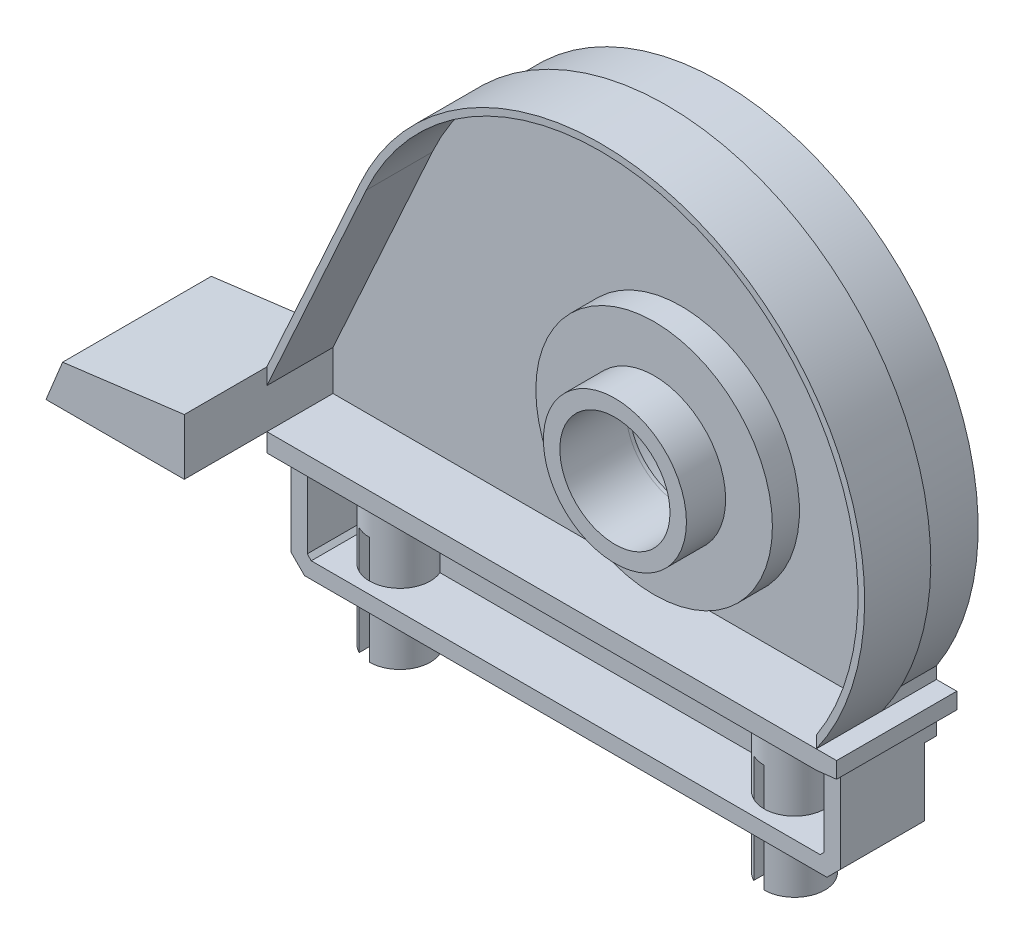
from build123d import *

# Parameters (mm, degrees)
BOSS_EXTRUDE1_DEPTH  = 4
SHELL1_T             = -1.2
SKETCH3_R            = 10.575
BOSS_EXTRUDE2_DEPTH  = 2.75
SKETCH4_R            = 8.7
SKETCH4_R_2          = 7.595
BOSS_EXTRUDE3_DEPTH  = 0.5
CHAMFER1_SIZE        = 2.75
CUT_EXTRUDE2_START   = -3.68
SKETCH5_R            = 7.595
CUT_EXTRUDE2_DEPTH   = 3.68
SKETCH6_R            = 4.09
CUT_EXTRUDE3_DEPTH   = 3.68
SKETCH7_W            = 40.64
SKETCH7_H            = 4.5
BOSS_EXTRUDE5_DEPTH  = 6
SKETCH18_W           = 40.64
SKETCH18_H           = 4.5
CUT_EXTRUDE10_DEPTH  = 2
BOSS_EXTRUDE16_DEPTH = 4.89
SKETCH20_W           = 40.64
SKETCH20_H           = 1.367101803
BOSS_EXTRUDE17_DEPTH = 4.89
BOSS_EXTRUDE18_DEPTH = 4.89
BOSS_EXTRUDE19_DEPTH = 4
BOSS_EXTRUDE24_DEPTH = 11
SKETCH31_W           = 40.64
SKETCH31_H           = 6.21
BOSS_EXTRUDE32_DEPTH = 6
CHAMFER2_SIZE        = 1
CHAMFER3_SIZE        = 1
SKETCH32_R           = 2.25
BOSS_EXTRUDE33_DEPTH = 4
SKETCH33_R           = 2.25
BOSS_EXTRUDE34_DEPTH = 4
SKETCH34_R           = 1
CUT_EXTRUDE14_DEPTH  = 8
CUT_EXTRUDE16_DEPTH  = 8
SKETCH37_R           = 1
CUT_EXTRUDE17_DEPTH  = 8
CUT_EXTRUDE19_DEPTH  = 8
SKETCH42_R           = 5.29
BOSS_EXTRUDE36_DEPTH = 4.9
SKETCH47_R           = 4.075
CUT_EXTRUDE21_DEPTH  = 21.9
SKETCH55_W           = 40.64
SKETCH55_H           = 3.105
BOSS_EXTRUDE47_DEPTH = 2.25
SKETCH59_W           = 1
SKETCH59_H           = 4
CUT_EXTRUDE29_DEPTH  = 1.08944
CUT_EXTRUDE35_DEPTH  = 4
BOSS_EXTRUDE54_START = 6
SKETCH70_R           = 2.25
BOSS_EXTRUDE54_DEPTH = 6
SKETCH66_R           = 8.75
BOSS_EXTRUDE66_DEPTH = 2
SKETCH71_R           = 2.25
BOSS_EXTRUDE71_DEPTH = 6
CUT_EXTRUDE39_DEPTH  = 8
CUT_EXTRUDE40_START  = -8
CUT_EXTRUDE40_DEPTH  = 8
SKETCH73_W           = 1
SKETCH73_H           = 4
CUT_EXTRUDE41_DEPTH  = 1.089436
CUT_EXTRUDE42_DEPTH  = 6
CUT_EXTRUDE43_START  = -6
CUT_EXTRUDE43_DEPTH  = 6
SKETCH79_R           = 4.075
CUT_EXTRUDE47_DEPTH  = 7


with BuildPart() as part:
    # Sketch1 → Boss-Extrude1 (new body)
    with BuildSketch(Plane.XY):
        with BuildLine():
            Line((-24.108496543, -7.116270468), (-24.108496543, -5.046270468))
            Line((-24.108496543, -5.046270468), (-16.768496543, 11.136920555))
            ThreePointArc((-16.768496543, 11.136920555), (9.72561941, 19.969325243), (16.531503457, -7.116270468))
            Line((16.531503457, -7.116270468), (16.531503457, -11.616270468))
            Line((16.531503457, -11.616270468), (-24.108496543, -11.616270468))
            Line((-24.108496543, -11.616270468), (-24.108496543, -7.116270468))
        make_face()
    extrude(amount=BOSS_EXTRUDE1_DEPTH)

    # Shell1
    shell1_openings = [part.faces().sort_by_distance(p)[0] for p in [
        (-1.110099133, 3.328032684, 0),
    ]]
    offset(amount=SHELL1_T, openings=shell1_openings, kind=Kind.INTERSECTION)

    # Sketch3 → Boss-Extrude2 (add)
    with BuildSketch(Plane(origin=(0, 0, 2.8), x_dir=(-1, 0, 0), z_dir=(0, 0, -1))):
        with Locations((-1.644644565, 1.733101785)):
            Circle(SKETCH3_R)
    extrude(amount=BOSS_EXTRUDE2_DEPTH)

    # Sketch4 → Boss-Extrude3 (add)
    with BuildSketch(Plane(origin=(0, 0, 0.05), x_dir=(-1, 0, 0), z_dir=(0, 0, -1))):
        with Locations((-1.644644565, 1.733101785)):
            Circle(SKETCH4_R)
        with Locations((-1.644644565, 1.733101785)):
            Circle(SKETCH4_R_2, mode=Mode.SUBTRACT)
    extrude(amount=BOSS_EXTRUDE3_DEPTH)

    # Chamfer1
    # the kernel refuses this chamfer: 2.75 mm, written as the material it takes off along each edge
    with BuildSketch(Plane(origin=(1.644644565, 1.733101785, 0.05), x_dir=(-1, 0, 0), z_dir=(0, -1, 0))) as chamfer1_piece_1_section:
        Polygon((10.575, -CHAMFER1_SIZE), (10.575 - CHAMFER1_SIZE, 0), (10.575, 0), align=None)
    chamfer1_piece_1 = revolve(axis=Axis((1.644644565, 1.733101785, 0.05), (0, 0, -1)), mode=Mode.PRIVATE)
    chamfer1_piece_1 = split(chamfer1_piece_1, bisect_by=Plane(origin=(11.325301981, 1.733101785, 2.8), z_dir=(0, 0, -1)), keep=Keep.TOP, mode=Mode.PRIVATE)
    chamfer1_piece_1 = chamfer1_piece_1 - Plane(origin=(1.644644565, 1.733101785, 1.819342584), x_dir=(-1, 0, 0), z_dir=(0, 0, 1)) * Cylinder(8.7, 43, mode=Mode.PRIVATE)
    add(chamfer1_piece_1, mode=Mode.SUBTRACT)

    # Sketch5 → Cut-Extrude2 (cut)
    with BuildSketch(Plane(origin=(0, 0, 0.05), x_dir=(-1, 0, 0), z_dir=(0, 0, -1)).offset(CUT_EXTRUDE2_START)):
        with Locations((-1.644644565, 1.733101785)):
            Circle(SKETCH5_R)
    extrude(amount=CUT_EXTRUDE2_DEPTH, mode=Mode.SUBTRACT)

    # Sketch6 → Cut-Extrude3 (cut)
    with BuildSketch(Plane(origin=(0, 0, 3.73), x_dir=(-1, 0, 0), z_dir=(0, 0, -1))):
        with Locations((-1.644644565, 1.733101785)):
            Circle(SKETCH6_R)
    extrude(amount=-CUT_EXTRUDE3_DEPTH, mode=Mode.SUBTRACT)

    # Sketch7 → Boss-Extrude5 (add)
    with BuildSketch(Plane.XY):
        with Locations((-3.788496543, -9.366270468)):
            Rectangle(SKETCH7_W, SKETCH7_H)
    extrude(amount=BOSS_EXTRUDE5_DEPTH)

    # Sketch18 → Cut-Extrude10 (cut)
    with BuildSketch(Plane.XY.offset(6)):
        with Locations((-3.788496543, -9.366270468)):
            Rectangle(SKETCH18_W, SKETCH18_H)
    extrude(amount=-CUT_EXTRUDE10_DEPTH, mode=Mode.SUBTRACT)

    # Sketch20 → Boss-Extrude17 (add)
    with BuildSketch(Plane.XY.offset(4)):
        with Locations((-3.788496543, -8.682719567)):
            Rectangle(SKETCH20_W, SKETCH20_H)
    extrude(amount=BOSS_EXTRUDE17_DEPTH)

    # Sketch21 → Boss-Extrude18 (add)
    with BuildSketch(Plane.XY.offset(4)):
        Polygon((16.531503457, -7.999168665), (18.031503457, -7.999168665), (18.031503457, -9.199168665), (16.531503457, -9.366270468), align=None)
    extrude(amount=BOSS_EXTRUDE18_DEPTH)

    # Sketch22 → Boss-Extrude19 (add)
    with BuildSketch(Plane(origin=(0, 0, 4), x_dir=(-1, 0, 0), z_dir=(0, 0, -1))):
        Polygon((-16.531503457, -7.999168665), (-18.031503457, -7.999168665), (-18.031503457, -9.199168665), (-16.531503457, -9.366270468), align=None)
    extrude(amount=BOSS_EXTRUDE19_DEPTH)

    # Sketch31 → Boss-Extrude32 (add)
    with BuildSketch(Plane.XZ.offset(11.616270468)):
        with Locations((-3.788496543, 4)):
            Rectangle(SKETCH31_W, SKETCH31_H)
    extrude(amount=BOSS_EXTRUDE32_DEPTH)

    # Chamfer2
    chamfer2_edges = [part.edges().sort_by_distance(p)[0] for p in [
        (-24.108496543, -17.616270468, 4),
    ]]
    chamfer(chamfer2_edges, length=CHAMFER2_SIZE)

    # Chamfer3
    chamfer3_edges = [part.edges().sort_by_distance(p)[0] for p in [
        (16.531503457, -17.616270468, 4),
    ]]
    chamfer(chamfer3_edges, length=CHAMFER3_SIZE)

    # Sketch32 → Boss-Extrude33 (add)
    with BuildSketch(Plane.XZ.offset(17.616270468)):
        with Locations(Location((-19.158496543, 4, 0), (0, 0, 90))):
            Circle(SKETCH32_R)
    extrude(amount=BOSS_EXTRUDE33_DEPTH)

    # Sketch33 → Boss-Extrude34 (add)
    with BuildSketch(Plane.XZ.offset(17.616270468)):
        with Locations(Location((10.031503457, 4, 0), (0, 0, 90))):
            Circle(SKETCH33_R)
    extrude(amount=BOSS_EXTRUDE34_DEPTH)

    # Sketch34 → Cut-Extrude14 (cut)
    with BuildSketch(Plane.XZ.offset(21.616270468)):
        with Locations(Location((-19.158496543, 4, 0), (0, 0, 270))):
            Circle(SKETCH34_R)
    extrude(amount=-CUT_EXTRUDE14_DEPTH, mode=Mode.SUBTRACT)

    # Sketch36 → Cut-Extrude16 (cut)
    with BuildSketch(Plane(origin=(0, -21.616270468, 0), x_dir=(-1, 0, 0), z_dir=(0, -1, 0))):
        with BuildLine():
            Line((18.158496543, -4), (18.158496543, -1.984435563))
            ThreePointArc((18.158496543, -1.984435563), (18.644940306, -1.80939278), (19.158496543, -1.75))
            Line((19.158496543, -1.75), (19.158496543, -3))
            ThreePointArc((19.158496543, -3), (18.451389761, -3.292893219), (18.158496543, -4))
        make_face()
    extrude(amount=-CUT_EXTRUDE16_DEPTH, mode=Mode.SUBTRACT)

    # Sketch37 → Cut-Extrude17 (cut)
    with BuildSketch(Plane.XZ.offset(21.616270468)):
        with Locations(Location((10.031503457, 4, 0), (0, 0, 270))):
            Circle(SKETCH37_R)
    extrude(amount=-CUT_EXTRUDE17_DEPTH, mode=Mode.SUBTRACT)

    # Sketch39 → Cut-Extrude19 (cut)
    with BuildSketch(Plane(origin=(0, -21.616270468, 0), x_dir=(-1, 0, 0), z_dir=(0, -1, 0))):
        with BuildLine():
            Line((-11.031503457, -4), (-11.031503457, -1.984435563))
            ThreePointArc((-11.031503457, -1.984435563), (-10.545059694, -1.80939278), (-10.031503457, -1.75))
            Line((-10.031503457, -1.75), (-10.031503457, -3))
            ThreePointArc((-10.031503457, -3), (-10.738610239, -3.292893219), (-11.031503457, -4))
        make_face()
    extrude(amount=-CUT_EXTRUDE19_DEPTH, mode=Mode.SUBTRACT)

    # Sketch42 → Boss-Extrude36 (add)
    with BuildSketch(Plane.XY.offset(4)):
        with Locations(Location((1.644644565, 1.733101785, 0), (0, 0, 180))):
            Circle(SKETCH42_R)
    extrude(amount=BOSS_EXTRUDE36_DEPTH)

    # Sketch47 → Cut-Extrude21 (cut)
    with BuildSketch(Plane.XY.offset(8.9)):
        with Locations((1.644644565, 1.733101785)):
            Circle(SKETCH47_R)
    extrude(amount=-CUT_EXTRUDE21_DEPTH, mode=Mode.SUBTRACT)

    # Sketch55 → Boss-Extrude47 (add)
    with BuildSketch(Plane(origin=(0, -11.616270468, 0), x_dir=(1, 0, 0), z_dir=(0, 1, 0))):
        with Locations((-3.788496543, -5.5525)):
            Rectangle(SKETCH55_W, SKETCH55_H)
    extrude(amount=BOSS_EXTRUDE47_DEPTH)

    # Sketch59 → Cut-Extrude29 (cut)
    with BuildSketch(Plane(origin=(0, 0, 0.895), x_dir=(-1, 0, 0), z_dir=(0, 0, -1))):
        with Locations((18.658496543, -15.616270468)):
            Rectangle(SKETCH59_W, SKETCH59_H)
    extrude(amount=-CUT_EXTRUDE29_DEPTH, mode=Mode.SUBTRACT)

    # Sketch68 → Cut-Extrude35 (cut)
    with BuildSketch(Plane.XY.offset(7.105)):
        Polygon((-22.908496543, -10.566270468), (15.331503457, -10.566270468), (15.331503457, -16.119214193), (15.034447183, -16.416270468), (-22.611440268, -16.416270468), (-22.908496543, -16.119214193), align=None)
    extrude(amount=-CUT_EXTRUDE35_DEPTH, mode=Mode.SUBTRACT)

    # Sketch70 → Boss-Extrude54 (add)
    with BuildSketch(Plane(origin=(0, -16.416270468, 0), x_dir=(1, 0, 0), z_dir=(0, 1, 0)).offset(BOSS_EXTRUDE54_START)):
        with Locations((-19.158496543, -4)):
            Circle(SKETCH70_R)
    extrude(amount=-BOSS_EXTRUDE54_DEPTH)

    # Sketch66 → Boss-Extrude66 (add)
    with BuildSketch(Plane.XY.offset(4)):
        with Locations(Location((1.644644565, 1.733101785, 0), (0, 0, 180))):
            Circle(SKETCH66_R)
    extrude(amount=BOSS_EXTRUDE66_DEPTH)

    # Sketch71 → Boss-Extrude71 (add)
    with BuildSketch(Plane(origin=(0, -16.416270468, 0), x_dir=(1, 0, 0), z_dir=(0, 1, 0))):
        with Locations((10.031503457, -4)):
            Circle(SKETCH71_R)
    extrude(amount=BOSS_EXTRUDE71_DEPTH)

    # Sketch38 → Cut-Extrude39 (cut)
    with BuildSketch(Plane(origin=(0, -21.616270468, 0), x_dir=(-1, 0, 0), z_dir=(0, -1, 0))):
        with BuildLine():
            Line((-9.031503457, -4), (-9.031503457, -6.015564437))
            ThreePointArc((-9.031503457, -6.015564437), (-9.517947221, -6.19060722), (-10.031503457, -6.25))
            Line((-10.031503457, -6.25), (-10.031503457, -5))
            ThreePointArc((-10.031503457, -5), (-9.324396676, -4.707106781), (-9.031503457, -4))
        make_face()
    extrude(amount=-CUT_EXTRUDE39_DEPTH, mode=Mode.SUBTRACT)

    # Sketch69 → Cut-Extrude40 (cut)
    with BuildSketch(Plane.XZ.offset(21.616270468).offset(CUT_EXTRUDE40_START)):
        with BuildLine():
            Line((-20.158496543, 4), (-20.158496543, 6.015564437))
            ThreePointArc((-20.158496543, 6.015564437), (-19.672052779, 6.19060722), (-19.158496543, 6.25))
            Line((-19.158496543, 6.25), (-19.158496543, 5))
            ThreePointArc((-19.158496543, 5), (-19.865603324, 4.707106781), (-20.158496543, 4))
        make_face()
    extrude(amount=CUT_EXTRUDE40_DEPTH, mode=Mode.SUBTRACT)

    # Sketch73 → Cut-Extrude41 (cut)
    with BuildSketch(Plane(origin=(0, 0, 0.895), x_dir=(-1, 0, 0), z_dir=(0, 0, -1))):
        with Locations((-10.531503457, -15.616270468)):
            Rectangle(SKETCH73_W, SKETCH73_H)
    extrude(amount=-CUT_EXTRUDE41_DEPTH, mode=Mode.SUBTRACT)

    # Sketch74 → Cut-Extrude42 (cut)
    with BuildSketch(Plane.XZ.offset(16.416270468)):
        with BuildLine():
            Line((11.031503457, 1.984435563), (10.031503457, 1.984435563))
            Line((10.031503457, 1.984435563), (10.031503457, 3))
            ThreePointArc((10.031503457, 3), (9.324396676, 4.707106781), (11.031503457, 4))
            Line((11.031503457, 4), (11.031503457, 1.984435563))
        make_face()
    extrude(amount=-CUT_EXTRUDE42_DEPTH, mode=Mode.SUBTRACT)

    # Sketch75 → Cut-Extrude43 (cut)
    with BuildSketch(Plane.XZ.offset(16.416270468).offset(CUT_EXTRUDE43_START)):
        with BuildLine():
            Line((-18.158496543, 1.984435563), (-18.158496543, 4))
            ThreePointArc((-18.158496543, 4), (-19.865603324, 4.707106781), (-19.158496543, 3))
            Line((-19.158496543, 3), (-19.158496543, 1.75))
            ThreePointArc((-19.158496543, 1.75), (-18.644940306, 1.80939278), (-18.158496543, 1.984435563))
        make_face()
    extrude(amount=CUT_EXTRUDE43_DEPTH, mode=Mode.SUBTRACT)

    # Sketch79 → Cut-Extrude47 (cut)
    with BuildSketch(Plane.XY.offset(6)):
        with Locations((1.644644565, 1.733101785)):
            Circle(SKETCH79_R)
    extrude(amount=-CUT_EXTRUDE47_DEPTH, mode=Mode.SUBTRACT)


with BuildPart() as body_2:
    # Sketch19 → Boss-Extrude16 (new body)
    with BuildSketch(Plane.XY.offset(4)):
        with BuildLine():
            Line((-24.108496543, -5.046270468), (-24.108496543, -3.846270468))
            Line((-24.108496543, -3.846270468), (-17.219904126, 11.341659636))
            ThreePointArc((-17.219904126, 11.341659636), (10.286675812, 20.223038003), (16.531503457, -7.999168665))
            Line((16.531503457, -7.999168665), (16.531503457, -7.116270468))
            ThreePointArc((16.531503457, -7.116270468), (9.72561941, 19.969325243), (-16.768496543, 11.136920555))
            Line((-16.768496543, 11.136920555), (-24.108496543, -5.046270468))
        make_face()
    extrude(amount=BOSS_EXTRUDE16_DEPTH)

    # Sketch23 → Boss-Extrude24 (add)
    with BuildSketch(Plane.XY.offset(4)):
        Polygon((-24.108496543, -3.846270468), (-24.108496543, -7.999168665), (-34.338496543, -7.999168665), (-33.108496543, -4.990913357), align=None)
    extrude(amount=BOSS_EXTRUDE24_DEPTH)


solid = Compound([part.part, body_2.part])
